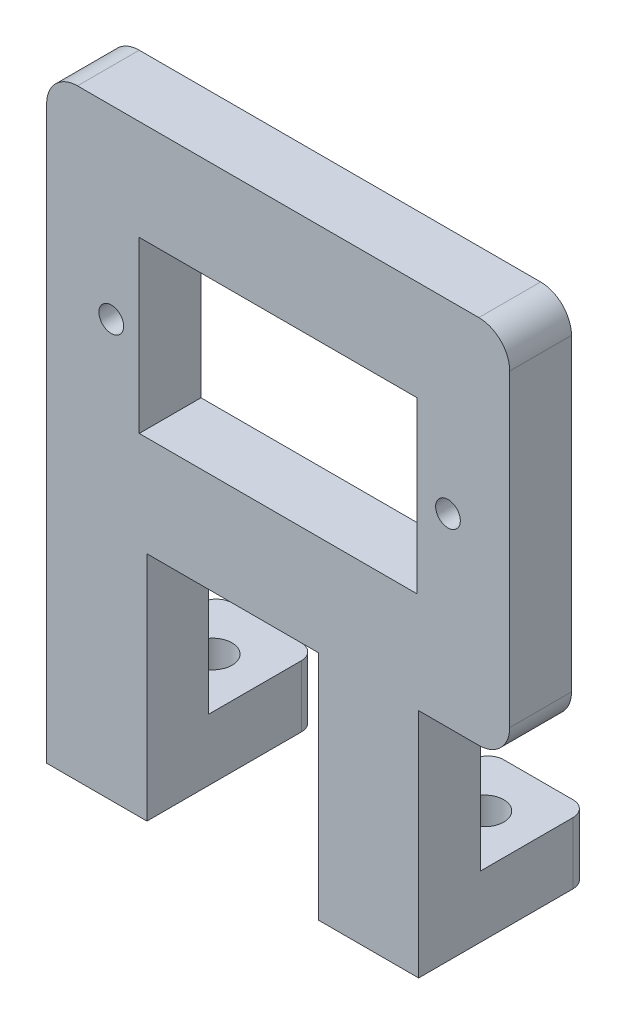
from build123d import *

# Parameters (mm, degrees)
SKETCH1_W           = 8.255
SKETCH1_H           = 19.05
SKETCH1_W_2         = 22.86
SKETCH1_H_2         = 13.97
BOSS_EXTRUDE1_DEPTH = 5.08
FILLET4_R           = 2.54
SKETCH3_W           = 8.255
SKETCH3_H           = 8.89
BOSS_EXTRUDE2_DEPTH = 5.08
SKETCH6_R           = 1.6
CUT_EXTRUDE2_DEPTH  = 5.08
FILLET3_R           = 1.27
SKETCH7_R           = 1.016
CUT_EXTRUDE3_DEPTH  = 41.22112256


with BuildPart() as part:
    # Sketch1 → Boss-Extrude1 (new body)
    # profile 1 of 3: a face of its own
    with BuildSketch(Plane.XY):
        with Locations((-14.9225, -24.765)):
            Rectangle(SKETCH1_W, SKETCH1_H)
    # profile 2 of 3: a face of its own
    with BuildSketch(Plane.XY):
        Polygon((-19.05, 15.24), (-19.05, -15.24), (-10.795, -15.24), (3.302, -15.24), (11.557, -15.24), (19.05, -15.24), (19.05, 15.24), align=None)
        Rectangle(SKETCH1_W_2, SKETCH1_H_2, mode=Mode.SUBTRACT)
    # profile 3 of 3: a face of its own
    with BuildSketch(Plane.XY):
        with Locations((7.4295, -24.765)):
            Rectangle(SKETCH1_W, SKETCH1_H)
    extrude(amount=BOSS_EXTRUDE1_DEPTH)

    # Fillet4
    fillet4_edges = [part.edges().sort_by_distance(p)[0] for p in [
        (19.05, 15.24, 2.54),
        (-19.05, 15.24, 2.54),
        (19.05, -15.24, 2.54),
    ]]
    fillet(fillet4_edges, radius=FILLET4_R)

    # Sketch3 → Boss-Extrude2 (add)
    with BuildSketch(Plane(origin=(0, -34.29, 0), x_dir=(1, 0, 0), z_dir=(0, 1, 0))):
        with Locations((-14.9225, 4.445)):
            Rectangle(SKETCH3_W, SKETCH3_H)
    boss_extrude2 = extrude(amount=BOSS_EXTRUDE2_DEPTH)

    # Sketch6 → Cut-Extrude2 (cut)
    with BuildSketch(Plane(origin=(0, -29.21, 0), x_dir=(1, 0, 0), z_dir=(0, 1, 0))):
        with Locations((-14.9225, 4.445)):
            Circle(SKETCH6_R)
    cut_extrude2 = extrude(amount=-CUT_EXTRUDE2_DEPTH, mode=Mode.SUBTRACT)

    # Mirror2: Boss-Extrude2, Cut-Extrude2 across plane
    add(boss_extrude2.mirror(Plane.ZY.offset(3.7465)))
    add(cut_extrude2.mirror(Plane.ZY.offset(3.7465)), mode=Mode.SUBTRACT)

    # Fillet3
    fillet3_edges = [part.edges().sort_by_distance(p)[0] for p in [
        (-10.795, -31.75, -8.89),
        (11.557, -31.75, -8.89),
        (3.302, -31.75, -8.89),
        (-19.05, -31.75, -8.89),
    ]]
    fillet(fillet3_edges, radius=FILLET3_R)

    # Sketch7 → Cut-Extrude3 (cut, through all)
    with BuildSketch(Plane(origin=(0, 0, 0), x_dir=(-1, 0, 0), z_dir=(0, 0, -1))):
        with Locations((-13.97, 0)):
            Circle(SKETCH7_R)
        with Locations((13.7299954, 0)):
            Circle(SKETCH7_R)
    extrude(amount=-CUT_EXTRUDE3_DEPTH, mode=Mode.SUBTRACT)


solid = part.part
